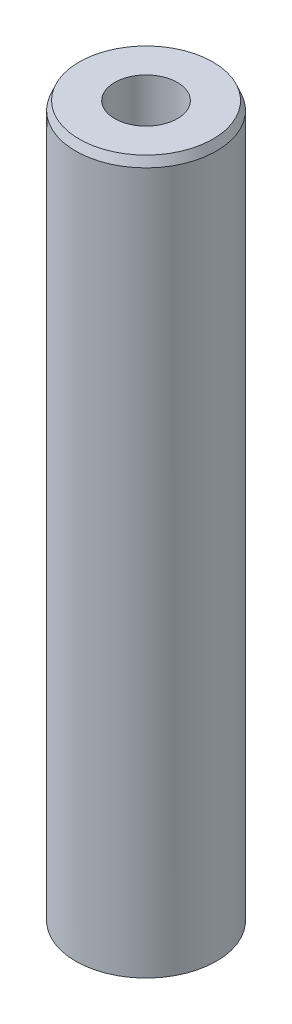
from build123d import *
from OCP.BRepFilletAPI import BRepFilletAPI_MakeChamfer

# Parameters (mm, degrees)
SKETCH1_R           = 37.5
BOSS_EXTRUDE1_DEPTH = 380.440647834
SKETCH2_R           = 16.725978367
CUT_EXTRUDE1_DEPTH  = 385.119234775
CHAMFER1_SIZE       = 4.592341243
CHAMFER1_SIZE2      = 1.864450306


with BuildPart() as part:
    # Sketch1 → Boss-Extrude1 (new body)
    with BuildSketch(Plane(origin=(0, 0, 0), x_dir=(1, 0, 0), z_dir=(0, 1, 0))):
        Circle(SKETCH1_R)
    extrude(amount=BOSS_EXTRUDE1_DEPTH)

    # Sketch2 → Cut-Extrude1 (cut, through all)
    with BuildSketch(Plane(origin=(0, 0, 0), x_dir=(1, 0, 0), z_dir=(0, 1, 0))):
        Circle(SKETCH2_R)
    extrude(amount=CUT_EXTRUDE1_DEPTH, mode=Mode.SUBTRACT)

    # Chamfer1: one chamfer whose edges measure the first distance from different faces: ONE call of the kernel's chamfer builder (chamfer() names one face for all edges)
    chamfer1_edges_1 = [part.edges().sort_by_distance(p)[0] for p in [
        (-37.5, 380.440647834, 0),
    ]]
    chamfer1_side_1 = [part.faces().sort_by_distance(p)[0] for p in [
        (-37.5, 190.220323917, 0),
    ]]
    chamfer1_edges_2 = [part.edges().sort_by_distance(p)[0] for p in [
        (-37.5, 0, 0),
    ]]
    chamfer1_side_2 = [part.faces().sort_by_distance(p)[0] for p in [
        (-36.439339828, 0, 0),
    ]]
    chamfer1 = BRepFilletAPI_MakeChamfer(part.part.solid().wrapped)
    for e in chamfer1_edges_1:
        chamfer1.Add(CHAMFER1_SIZE, CHAMFER1_SIZE2, e.wrapped, chamfer1_side_1[0].wrapped)  # the first distance lies on this face
    for e in chamfer1_edges_2:
        chamfer1.Add(CHAMFER1_SIZE, CHAMFER1_SIZE2, e.wrapped, chamfer1_side_2[0].wrapped)  # the first distance lies on this face
    add(Compound.cast(chamfer1.Shape()), mode=Mode.REPLACE)


solid = part.part
